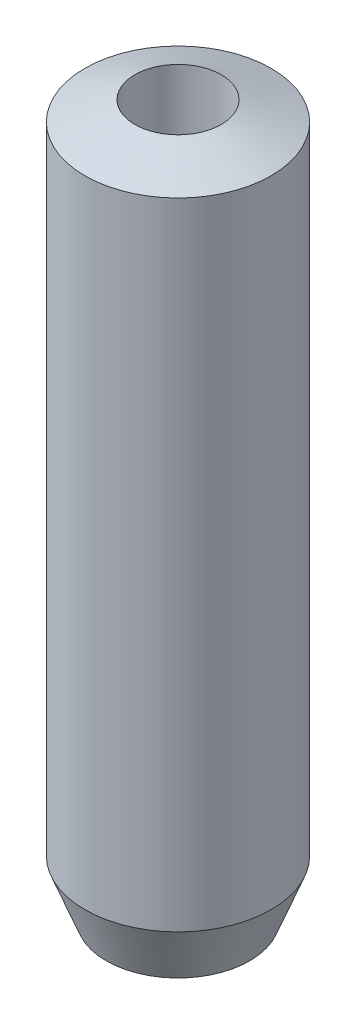
from build123d import *

# Parameters (mm, degrees)
SKETCH1_R           = 7.5
BOSS_EXTRUDE1_DEPTH = 57.354291
SKETCH2_R           = 3.476245498
CUT_EXTRUDE1_DEPTH  = 59.326792267
CHAMFER1_SIZE       = 1.722726
CHAMFER1_SIZE_2     = 4.433216


with BuildPart() as part:
    # Sketch1 → Boss-Extrude1 (new body)
    with BuildSketch(Plane(origin=(0, 0, 0), x_dir=(1, 0, 0), z_dir=(0, 1, 0))):
        with Locations(Location((0, 0, 0), (0, 0, 90))):
            Circle(SKETCH1_R)
    extrude(amount=BOSS_EXTRUDE1_DEPTH)

    # Sketch2 → Cut-Extrude1 (cut, through all)
    with BuildSketch(Plane(origin=(0, 0, 0), x_dir=(1, 0, 0), z_dir=(0, 1, 0))):
        with Locations(Location((0, 0, 0), (0, 0, 90))):
            Circle(SKETCH2_R)
    extrude(amount=CUT_EXTRUDE1_DEPTH, mode=Mode.SUBTRACT)

    # Chamfer1
    # the kernel refuses this chamfer: 4.433216, 1.722726 mm, written as the material it takes off along each edge
    with BuildSketch(Plane(origin=(0, 57.354291, 0), x_dir=(0, 0, -1), z_dir=(1, 0, 0))) as chamfer1_piece_1:
        Polygon((7.5, -CHAMFER1_SIZE), (7.5 - CHAMFER1_SIZE_2, 0), (7.5, 0), align=None)
    revolve(axis=Axis((0, 57.354291, 0), (0, 1, 0)), mode=Mode.SUBTRACT)
    with BuildSketch(Plane(origin=(0, 0, 0), x_dir=(0, 0, -1), z_dir=(1, 0, 0))) as chamfer1_piece_2:
        Polygon((7.5, CHAMFER1_SIZE_2), (7.5 - CHAMFER1_SIZE, 0), (7.5, 0), align=None)
    revolve(axis=Axis((0, 0, 0), (0, 1, 0)), mode=Mode.SUBTRACT)


solid = part.part
